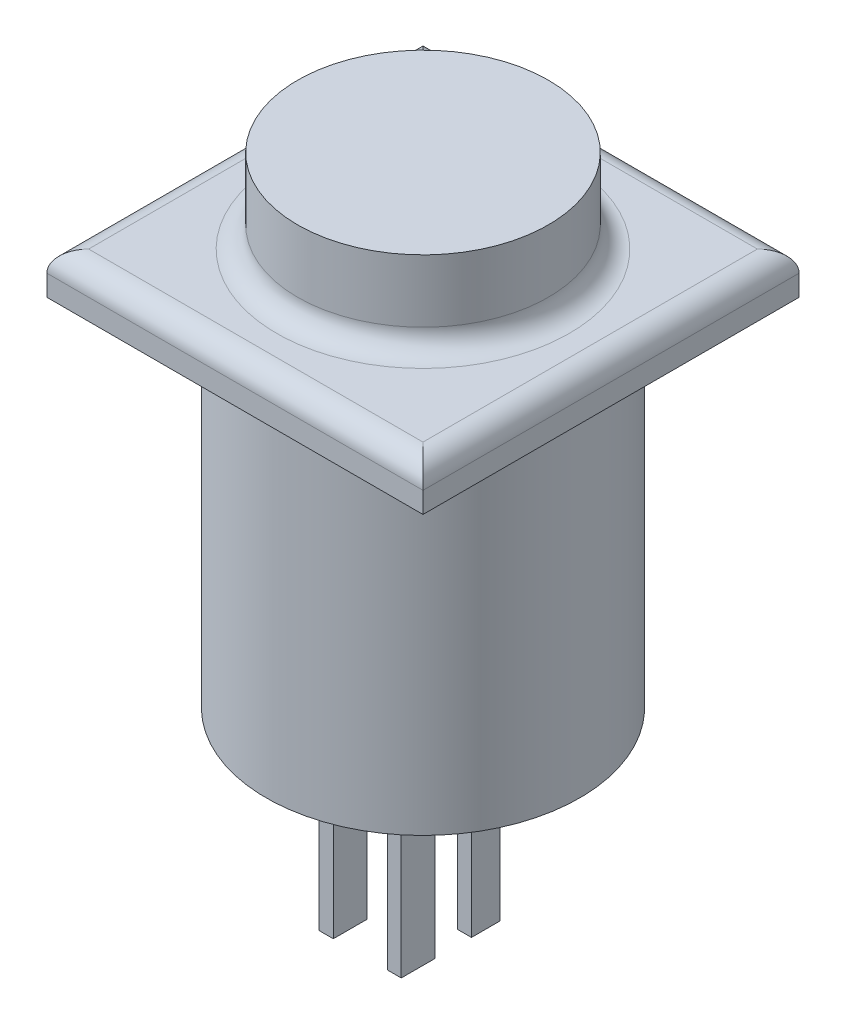
from build123d import *

# Parameters (mm, degrees)
IZIM1_R                     = 6
Y_KSEKLIK_EKSTR_ZYON1_DEPTH = 4
IZIM2_W                     = 18
IZIM2_H                     = 18
Y_KSEKLIK_EKSTR_ZYON2_DEPTH = 2
RADYUS1_R                   = 1
IZIM3_R                     = 7.5
Y_KSEKLIK_EKSTR_ZYON3_DEPTH = 17
IZIM4_W                     = 0.657456129
IZIM4_H                     = 1.607114982
IZIM4_W_2                   = 0.693981469
IZIM4_H_2                   = 1.369700268
Y_KSEKLIK_EKSTR_ZYON4_DEPTH = 7


with BuildPart() as part:
    # Çizim1 → Yükseklik-Ekstrüzyon1 (new body)
    with BuildSketch(Plane(origin=(0, 0, 0), x_dir=(1, 0, 0), z_dir=(0, 1, 0))):
        Circle(IZIM1_R)
    extrude(amount=Y_KSEKLIK_EKSTR_ZYON1_DEPTH)

    # Çizim2 → Yükseklik-Ekstrüzyon2 (add)
    with BuildSketch(Plane.XZ):
        Rectangle(IZIM2_W, IZIM2_H)
    extrude(amount=Y_KSEKLIK_EKSTR_ZYON2_DEPTH)

    # Radyus1
    radyus1_edges = [part.edges().sort_by_distance(p)[0] for p in [
        (0, 0, 9),
        (-9, 0, 0),
        (0, 0, -9),
        (9, 0, 0),
        (-6, 0, 0),
    ]]
    fillet(radyus1_edges, radius=RADYUS1_R)

    # Çizim3 → Yükseklik-Ekstrüzyon3 (add)
    with BuildSketch(Plane.XZ.offset(2)):
        Circle(IZIM3_R)
    extrude(amount=Y_KSEKLIK_EKSTR_ZYON3_DEPTH)

    # Çizim4 → Yükseklik-Ekstrüzyon4 (add)
    with BuildSketch(Plane.XZ.offset(19)):
        with Locations((3.360331326, 3.926474103)):
            Rectangle(IZIM4_W, IZIM4_H)
        with Locations((0.091313352, 3.926474103)):
            Rectangle(IZIM4_W_2, IZIM4_H)
        with Locations((3.360331326, 0.684850134)):
            Rectangle(IZIM4_W, IZIM4_H_2)
        with Locations((0.091313352, 0.684850134)):
            Rectangle(IZIM4_W_2, IZIM4_H_2)
    extrude(amount=Y_KSEKLIK_EKSTR_ZYON4_DEPTH)


solid = part.part
